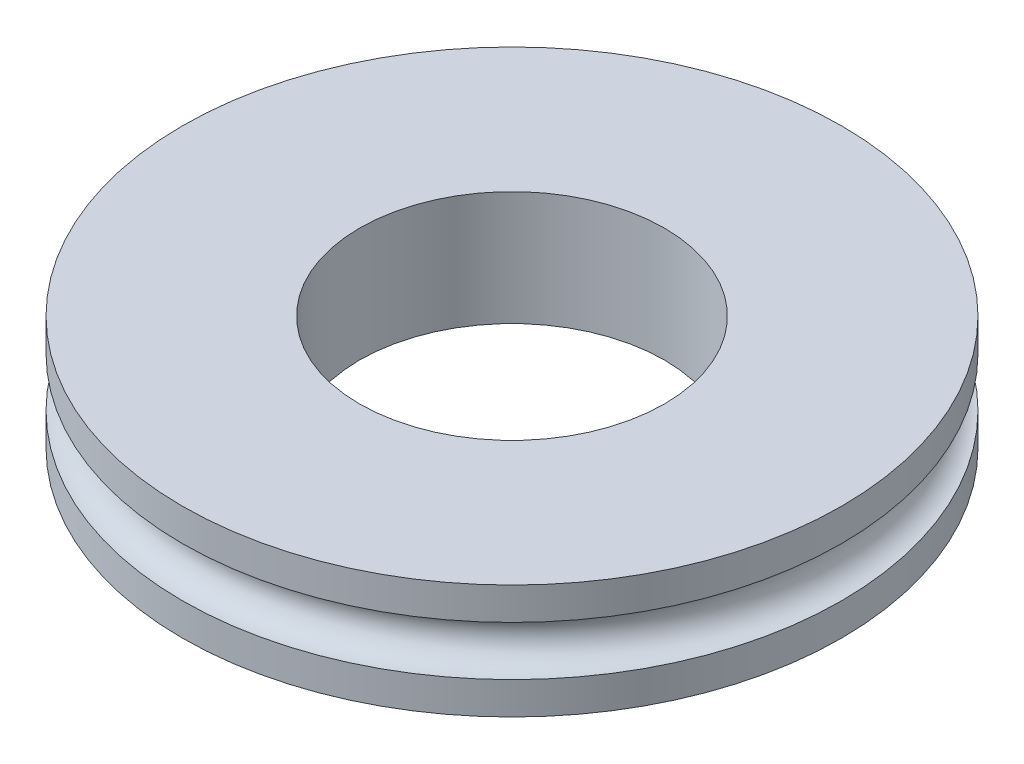
from build123d import *


with BuildPart() as part:
    # Sketch1 → Revolve1 (revolve)
    with BuildSketch(Plane.XY):
        with BuildLine():
            Line((4, 1.5), (4, -1.5))
            Line((4, -1.5), (8.65, -1.5))
            Line((8.65, -1.5), (8.65, -0.65))
            ThreePointArc((8.65, -0.65), (8, 0), (8.65, 0.65))
            Line((8.65, 0.65), (8.65, 1.5))
            Line((8.65, 1.5), (4, 1.5))
        make_face()
    revolve(axis=Axis((0, -1.5, 0), (0, 1, 0)))


solid = part.part
